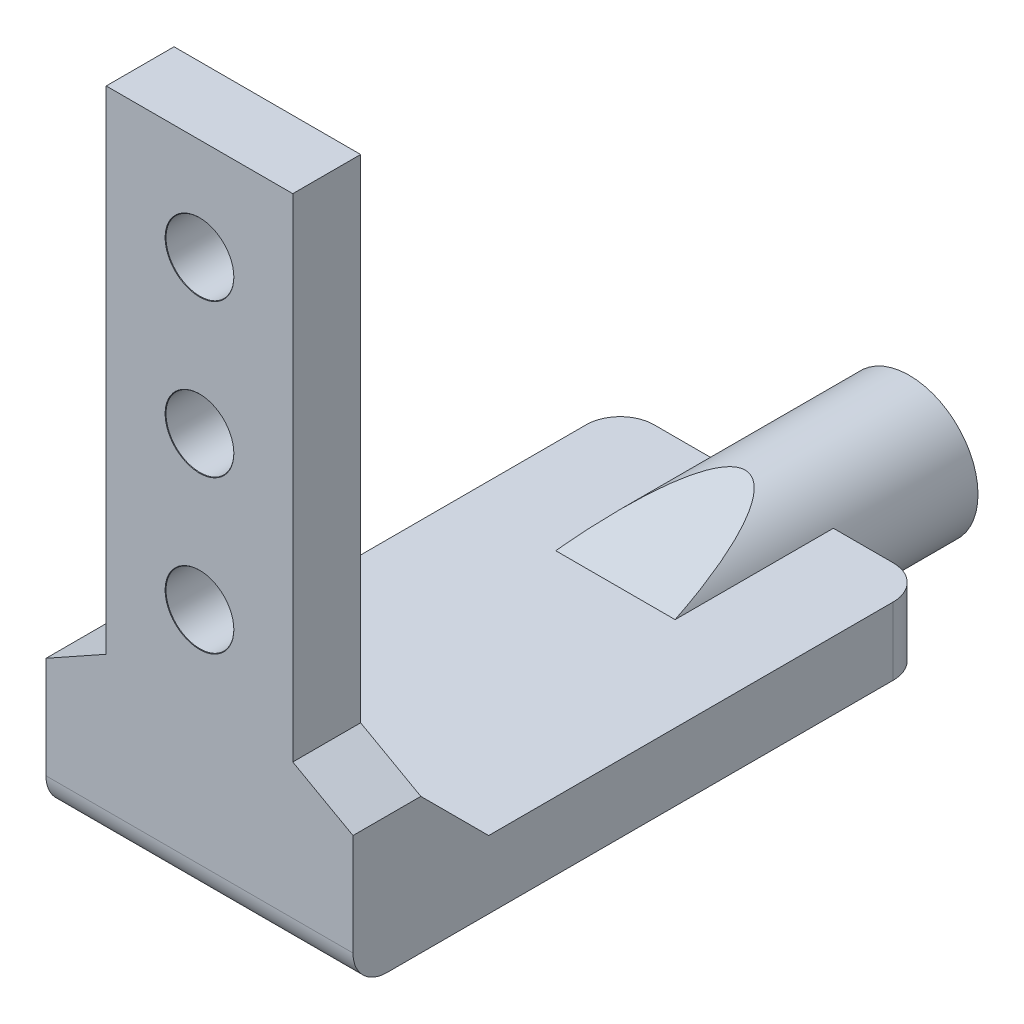
from build123d import *

# Parameters (mm, degrees)
SKETCH1_R                       = 4.05
BOSS_EXTRUDE1_DEPTH             = 8
SKETCH2_W                       = 18.1
SKETCH2_H                       = 4
BOSS_EXTRUDE2_DEPTH             = 33.85
CHAMFER1_SIZE                   = 2.5
CHAMFER1_SIZE_2                 = 9.330127019
CHAMFER2_SIZE                   = 9.330127019
CHAMFER2_SIZE_2                 = 2.5
FILLET1_R                       = 2
SKETCH3_W                       = 18.1
SKETCH3_H                       = 4
BOSS_EXTRUDE3_DEPTH             = 35
CHAMFER3_SIZE                   = 4
F_4_0MM_DOWEL_HOLE1_D           = 4
F_4_0MM_DOWEL_HOLE1_CSINK_D     = 4.05
F_4_0MM_DOWEL_HOLE1_CSINK_ANGLE = 90
FILLET2_R                       = 2
CUT_EXTRUDE1_DEPTH              = 54.698463665
CUT_EXTRUDE1_DEPTH_BACK         = 54.698463665
CUT_EXTRUDE2_DEPTH              = 54.698463665
CUT_EXTRUDE2_DEPTH_BACK         = 54.698463665


with BuildPart() as part:
    # Sketch1 → Boss-Extrude1 (new body)
    with BuildSketch(Plane.XY):
        Circle(SKETCH1_R)
    extrude(amount=BOSS_EXTRUDE1_DEPTH)

    # Sketch2 → Boss-Extrude2 (add)
    with BuildSketch(Plane.XY.offset(8)):
        Rectangle(SKETCH2_W, SKETCH2_H)
    extrude(amount=BOSS_EXTRUDE2_DEPTH)

    # Chamfer1
    # the kernel refuses this chamfer: 9.330127019, 2.5 mm, written as the material it adds along each edge
    with BuildSketch(Plane(origin=(27.749460413, 2, 8), x_dir=(0, 0.9905000388259542, -0.1375124470212913), z_dir=(-1, 0, 0))) as chamfer1_piece_1_section:
        Polygon((CHAMFER1_SIZE * 0.990500038826, -CHAMFER1_SIZE * 0.137512447021), (-CHAMFER1_SIZE_2 * 0.13751244702, -CHAMFER1_SIZE_2 * 0.990500038818), (0, 0), align=None)
    chamfer1_piece_1 = extrude(amount=55.498920827, mode=Mode.PRIVATE)
    chamfer1_piece_1 = chamfer1_piece_1 & Plane(origin=(0, 0, 11.423628779), x_dir=(1, 0, 0), z_dir=(0, 0, -1)) * Cylinder(4.05, 148, mode=Mode.PRIVATE)
    add(chamfer1_piece_1)

    # Chamfer2
    # the kernel refuses this chamfer: 9.330127019, 2.5 mm, written as the material it adds along each edge
    with BuildSketch(Plane(origin=(-27.749460413, -2, 8), x_dir=(0, 0.009967146577156291, 0.9999503267608394), z_dir=(1, 0, 0))) as chamfer2_piece_1_section:
        Polygon((CHAMFER2_SIZE * 0.999950326753, CHAMFER2_SIZE * 0.00996714657707), (-CHAMFER2_SIZE_2 * 0.00996714657716, CHAMFER2_SIZE_2 * 0.999950326761), (0, 0), align=None)
    chamfer2_piece_1 = extrude(amount=55.498920827, mode=Mode.PRIVATE)
    chamfer2_piece_1 = chamfer2_piece_1 & Plane(origin=(0, 0, 11.423628779), x_dir=(1, 0, 0), z_dir=(0, 0, -1)) * Cylinder(4.05, 149, mode=Mode.PRIVATE)
    add(chamfer2_piece_1)

    # Fillet1
    fillet1_edges = [part.edges().sort_by_distance(p)[0] for p in [
        (9.05, 0, 8),
        (-9.05, 0, 8),
    ]]
    fillet(fillet1_edges, radius=FILLET1_R)

    # Sketch3 → Boss-Extrude3 (add)
    with BuildSketch(Plane(origin=(0, 2, 0), x_dir=(1, 0, 0), z_dir=(0, 1, 0))):
        with Locations((0, -39.85)):
            Rectangle(SKETCH3_W, SKETCH3_H)
    extrude(amount=BOSS_EXTRUDE3_DEPTH)

    # Chamfer3
    chamfer3_edges = [part.edges().sort_by_distance(p)[0] for p in [
        (0, 2, 37.85),
    ]]
    chamfer(chamfer3_edges, length=CHAMFER3_SIZE)

    # Ø4.0mm Dowel Hole1 (through all)
    with Locations(Plane.XY.offset(41.85)):
        with Locations((0, 31), (0, 22), (0, 13)):
            CounterSinkHole(F_4_0MM_DOWEL_HOLE1_D / 2, F_4_0MM_DOWEL_HOLE1_CSINK_D / 2, counter_sink_angle=F_4_0MM_DOWEL_HOLE1_CSINK_ANGLE)

    # Fillet2
    fillet2_edges = [part.edges().sort_by_distance(p)[0] for p in [
        (0, -2, 41.85),
    ]]
    fillet(fillet2_edges, radius=FILLET2_R)

    # Sketch6 → Cut-Extrude1 (cut, two sides: drawn at the far end of the back side and taken through both)
    with BuildSketch(Plane(origin=(0, 0, 37.85), x_dir=(-1, 0, 0), z_dir=(0, 0, -1)).offset(-CUT_EXTRUDE1_DEPTH_BACK)):
        Polygon((-9.05, 6), (-5.5, 7.98), (-5.5, 37), (-9.05, 37), align=None)
    extrude(amount=CUT_EXTRUDE1_DEPTH + CUT_EXTRUDE1_DEPTH_BACK, mode=Mode.SUBTRACT)

    # Sketch7 → Cut-Extrude2 (cut, two sides: drawn at the far end of the back side and taken through both)
    with BuildSketch(Plane(origin=(0, 0, 37.85), x_dir=(-1, 0, 0), z_dir=(0, 0, -1)).offset(-CUT_EXTRUDE2_DEPTH_BACK)):
        Polygon((9.05, 6), (5.5, 7.98), (5.5, 37), (9.05, 37), align=None)
    extrude(amount=CUT_EXTRUDE2_DEPTH + CUT_EXTRUDE2_DEPTH_BACK, mode=Mode.SUBTRACT)


solid = part.part
